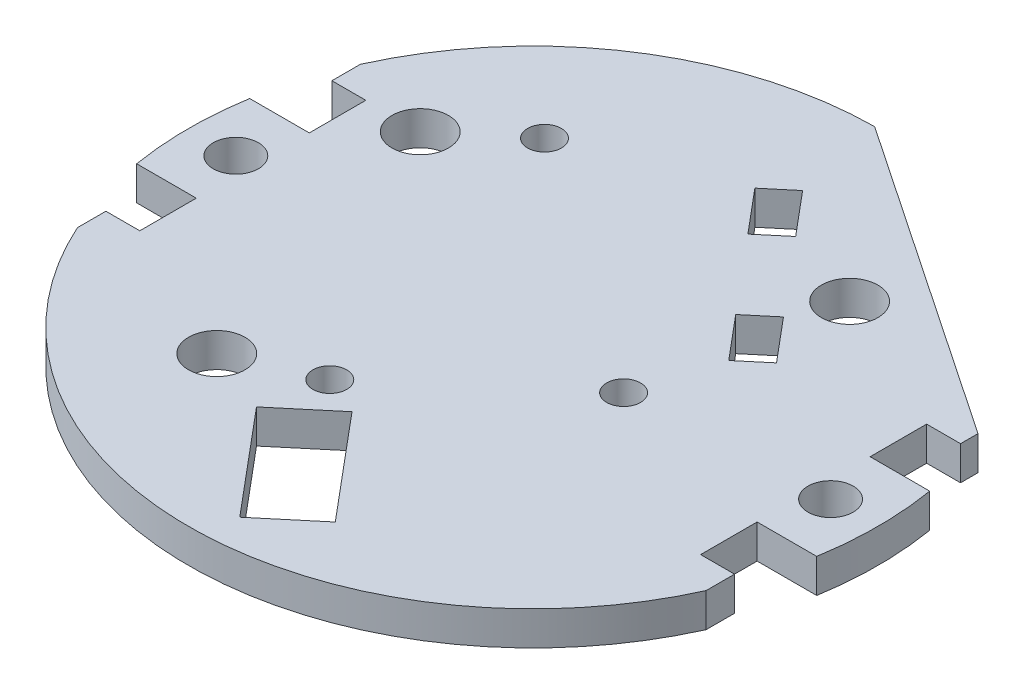
from build123d import *

# Parameters (mm, degrees)
CROQUIS1_R              = 30.5
SALIENTE_EXTRUIR1_DEPTH = 3
CORTAR_EXTRUIR3_START   = -4
CORTAR_EXTRUIR3_DEPTH   = 4
CORTAR_EXTRUIR5_DEPTH   = 4
CROQUIS8_R              = 2.5
CROQUIS8_R_2            = 1.5
CORTAR_EXTRUIR6_DEPTH   = 10
CORTAR_EXTRUIR8_START   = -3
CROQUIS10_R             = 2
CORTAR_EXTRUIR8_DEPTH   = 3
CORTAR_EXTRUIR9_START   = -3
CROQUIS11_R             = 2.5
CORTAR_EXTRUIR9_DEPTH   = 3


with BuildPart() as part:
    # Croquis1 → Saliente-Extruir1 (new body)
    with BuildSketch(Plane(origin=(0, 0, 0), x_dir=(1, 0, 0), z_dir=(0, 1, 0))):
        Circle(CROQUIS1_R)
    extrude(amount=SALIENTE_EXTRUIR1_DEPTH)

    # Croquis5 → Cortar-Extruir3 (cut)
    with BuildSketch(Plane(origin=(0, 3, 0), x_dir=(1, 0, 0), z_dir=(0, 1, 0)).offset(CORTAR_EXTRUIR3_START)):
        with BuildLine():
            Line((30.087372767, -5), (24.814059068, -5))
            Line((24.814059068, -5), (24.814059068, -10))
            Line((24.814059068, -10), (28.814059068, -10))
            ThreePointArc((28.814059068, -10), (29.556634924, -7.526973624), (30.087372767, -5))
        make_face()
        with BuildLine():
            Line((24.814059068, 5), (30.087372767, 5))
            ThreePointArc((30.087372767, 5), (29.556634924, 7.526973624), (28.814059068, 10))
            Line((28.814059068, 10), (24.814059068, 10))
            Line((24.814059068, 10), (24.814059068, 5))
        make_face()
        with BuildLine():
            ThreePointArc((-30.087372767, -5), (-29.556634924, -7.526973624), (-28.814059068, -10))
            Line((-28.814059068, -10), (-24.814059068, -10))
            Line((-24.814059068, -10), (-24.814059068, -5))
            Line((-24.814059068, -5), (-30.087372767, -5))
        make_face()
        with BuildLine():
            Line((-24.814059068, 10), (-28.814059068, 10))
            ThreePointArc((-28.814059068, 10), (-29.556634924, 7.526973624), (-30.087372767, 5))
            Line((-30.087372767, 5), (-24.814059068, 5))
            Line((-24.814059068, 5), (-24.814059068, 10))
        make_face()
    extrude(amount=CORTAR_EXTRUIR3_DEPTH, mode=Mode.SUBTRACT)

    # Croquis7 → Cortar-Extruir5 (cut)
    with BuildSketch(Plane(origin=(0, 3, 0), x_dir=(1, 0, 0), z_dir=(0, 1, 0))):
        Polygon((1.428390211, 22.411430151), (-0.869743118, 20.483067322), (2.34419493, 16.652845106), (4.642328259, 18.581207935), align=None)
        Polygon((10.266719844, 11.878319058), (7.968586515, 9.949956229), (11.182524563, 6.119734013), (13.480657893, 8.048096842), align=None)
    extrude(amount=-CORTAR_EXTRUIR5_DEPTH, mode=Mode.SUBTRACT)

    # Croquis8 → Cortar-Extruir6 (cut)
    with BuildSketch(Plane(origin=(0, 3, 0), x_dir=(1, 0, 0), z_dir=(0, 1, 0))):
        with Locations((12, 16)):
            Circle(CROQUIS8_R)
        with Locations((9, -1)):
            Circle(CROQUIS8_R_2)
        with Locations((-12, -16)):
            Circle(CROQUIS8_R)
        Polygon((-6.154858987, -18.33209617), (1.558592329, -27.524629488), (6.154858987, -23.66790383), (-1.558592329, -14.475370512), align=None)
        with Locations((-5, -13)):
            Circle(CROQUIS8_R_2)
        with Locations((-14, 15)):
            Circle(CROQUIS8_R_2)
    extrude(amount=-CORTAR_EXTRUIR6_DEPTH, mode=Mode.SUBTRACT)

    # Croquis10 → Cortar-Extruir8 (cut)
    with BuildSketch(Plane(origin=(0, 3, 0), x_dir=(1, 0, 0), z_dir=(0, 1, 0)).offset(CORTAR_EXTRUIR8_START)):
        with BuildLine():
            Line((-28.814059068, 10), (-27.814059068, 10))
            Line((-27.814059068, 10), (-27.814059068, 12.515115586))
            ThreePointArc((-27.814059068, 12.515115586), (-28.341972277, 11.268655974), (-28.814059068, 10))
        make_face()
        with BuildLine():
            ThreePointArc((28.814059069, 10), (28.341972277, 11.268655974), (27.814059069, 12.515115586))
            Line((27.814059069, 12.515115586), (27.814059069, 10))
            Line((27.814059069, 10), (28.814059069, 10))
        make_face()
        with BuildLine():
            Line((-27.814059068, -12.515115586), (-27.814059068, -10))
            Line((-27.814059068, -10), (-28.814059068, -10))
            ThreePointArc((-28.814059068, -10), (-28.341972277, -11.268655974), (-27.814059068, -12.515115586))
        make_face()
        with BuildLine():
            Line((27.814059069, -10), (27.814059069, -12.515115586))
            ThreePointArc((27.814059069, -12.515115586), (28.341972277, -11.268655974), (28.814059068, -10))
            Line((28.814059068, -10), (27.814059069, -10))
        make_face()
        with Locations((-26.314059068, 0)):
            Circle(CROQUIS10_R)
        with Locations((26.314059069, 0)):
            Circle(CROQUIS10_R)
    extrude(amount=CORTAR_EXTRUIR8_DEPTH, mode=Mode.SUBTRACT)

    # Croquis11 → Cortar-Extruir9 (cut)
    with BuildSketch(Plane(origin=(0, 3, 0), x_dir=(1, 0, 0), z_dir=(0, 1, 0)).offset(CORTAR_EXTRUIR9_START)):
        with BuildLine():
            Line((-0.28585192, 30.498660441), (27.814059069, 11.545031156))
            Line((27.814059069, 11.545031156), (27.814059069, 12.515115586))
            ThreePointArc((27.814059069, 12.515115586), (16.440879496, 25.689442995), (-0.28585192, 30.498660441))
        make_face()
        with Locations((-20, 10)):
            Circle(CROQUIS11_R)
    extrude(amount=CORTAR_EXTRUIR9_DEPTH, mode=Mode.SUBTRACT)


solid = part.part
